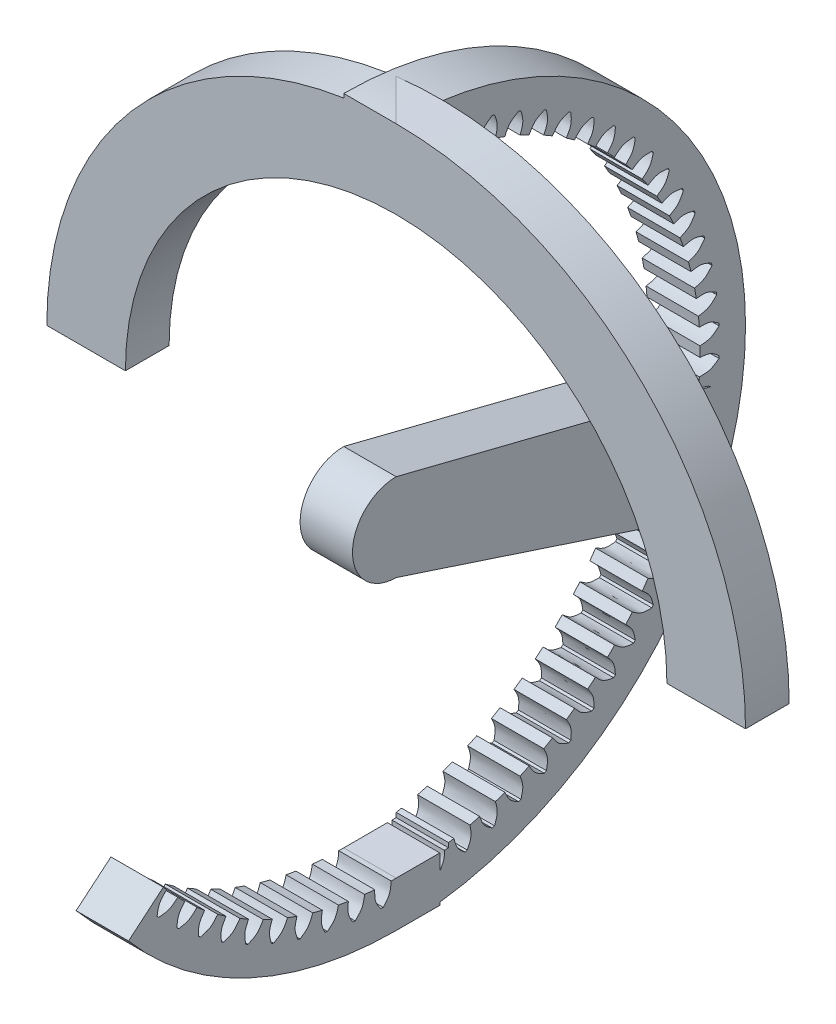
from build123d import *

# Parameters (mm, degrees)
RITNING_1_W         = 15
RITNING_1_H         = 31
KUGGLUCKA_DEPTH     = 15
CIRPATTERN_COUNT    = 72
SKETCH1_R           = 40
BOSS_EXTRUDE1_DEPTH = 6
COMBINE1_START      = -7.5
COMBINE1_DEPTH      = 15
CUT_EXTRUDE1_DEPTH  = 6
BOSS_EXTRUDE2_DEPTH = 6
SKETCH7_W           = 5
SKETCH7_H           = 9
CUT_EXTRUDE3_DEPTH  = 6


# Read off the part's stored shape, not the designer's step: Combine1
with BuildPart() as part:
    # Ritning 1 → Kugghjulsämne (revolve)
    with BuildSketch(Plane.XY, mode=Mode.PRIVATE) as kugghjuls_mne_sk:
        with Locations((0, 3)):
            Rectangle(RITNING_1_W, RITNING_1_H)
    revolve(kugghjuls_mne_sk.sketch.rotate(Axis((-7.5, -18.5, 0), (1, 0, 0)), 90), axis=Axis((-7.5, -18.5, 0), (1, 0, 0)))

    # Ritning 2 → Kugglucka (cut)
    with BuildSketch(Plane.ZY.offset(7.5)):
        with BuildLine():
            Line((1.471119099, 18.470742603), (0, 19.941861702))
            Line((0, 19.941861702), (-1.471119099, 18.470742603))
            add(Edge.make_bspline(
                [(-1.471119099, 18.470742603), (-1.203017898, 18.160678457), (-0.662530279, 17.535594229), (-0.603985126, 16.710882897), (-0.574480463, 16.295257898)],
                knots=[0, 0, 0, 0, 0.496035786, 1, 1, 1, 1], degree=3))
            ThreePointArc((-0.574480463, 16.295257898), (0, 16.3), (0.574480463, 16.295257898))
            add(Edge.make_bspline(
                [(1.471119099, 18.470742603), (1.203017898, 18.160678457), (0.662530279, 17.535594229), (0.603985126, 16.710882897), (0.574480463, 16.295257898)],
                knots=[0, 0, 0, 0, 0.496035786, 1, 1, 1, 1], degree=3))
        make_face()
    kugglucka = extrude(amount=-KUGGLUCKA_DEPTH, mode=Mode.SUBTRACT)

    # CirPattern: Kugglucka ×72 about axis
    cirpattern_axis = Axis((-7.5, -18.5, 0), (-1, 0, 0))
    for i in range(1, CIRPATTERN_COUNT):
        add(kugglucka.rotate(cirpattern_axis, i * 360 / CIRPATTERN_COUNT), mode=Mode.SUBTRACT)


with BuildPart() as body_2:
    # Sketch1 → Boss-Extrude1 (new body)
    with BuildSketch(Plane(origin=(7.5, 0, 0), x_dir=(0, 0, -1), z_dir=(1, 0, 0))):
        with Locations((0, -18.5)):
            Circle(SKETCH1_R)
    extrude(amount=-BOSS_EXTRUDE1_DEPTH)


with BuildPart() as combine1_tool:
    # Combine1 outline → Combine1 (new body)
    with BuildSketch(Plane.YZ.offset(COMBINE1_START)):
        with BuildLine():
            ThreePointArc((16.295257898, -0.574480463), (16.3, 0), (16.295257898, 0.574480463))
            add(Edge.make_bspline(
                [(16.295257898, 0.574480463), (16.710882897, 0.603985126), (17.535594229, 0.662530279), (18.160678457, 1.203017898), (18.470742603, 1.471119099)],
                knots=[0, 0, 0, 0, 0.503964214, 1, 1, 1, 1], degree=3))
            ThreePointArc((18.470742603, 1.471119099), (18.464784199, 1.613917333), (18.458274243, 1.756691485))
            add(Edge.make_bspline(
                [(18.458274243, 1.756691485), (18.126023425, 1.996748609), (17.456211232, 2.480699829), (16.629535629, 2.467143872), (16.212920708, 2.460312154)],
                knots=[0, 0, 0, 0, 0.496035786, 1, 1, 1, 1], degree=3))
            ThreePointArc((16.212920708, 2.460312154), (16.167575494, 3.033019847), (16.112782165, 3.604900938))
            add(Edge.make_bspline(
                [(16.112782165, 3.604900938), (16.524254084, 3.670517432), (17.340724595, 3.800718132), (17.916323588, 4.393628712), (18.201841288, 4.687733578)],
                knots=[0, 0, 0, 0, 0.503964214, 1, 1, 1, 1], degree=3))
            ThreePointArc((18.201841288, 4.687733578), (18.183459871, 4.829469112), (18.1645311, 4.971132586))
            add(Edge.make_bspline(
                [(18.1645311, 4.971132586), (17.81262224, 5.181318653), (17.103179757, 5.605050313), (16.280831383, 5.519496414), (15.866397232, 5.476380311)],
                knots=[0, 0, 0, 0, 0.496035786, 1, 1, 1, 1], degree=3))
            ThreePointArc((15.866397232, 5.476380311), (15.771309805, 6.042956583), (15.666882261, 6.60788594))
            add(Edge.make_bspline(
                [(15.666882261, 6.60788594), (16.07106955, 6.709114884), (16.873085406, 6.909980225), (17.394818509, 7.550801359), (17.653616799, 7.868671574)],
                knots=[0, 0, 0, 0, 0.503964214, 1, 1, 1, 1], degree=3))
            ThreePointArc((17.653616799, 7.868671574), (17.622952263, 8.008265716), (17.591748737, 8.147740366))
            add(Edge.make_bspline(
                [(17.591748737, 8.147740366), (17.222860074, 8.326455734), (16.479186586, 8.686742981), (15.66742401, 8.529842257), (15.258324721, 8.450769907)],
                knots=[0, 0, 0, 0, 0.496035786, 1, 1, 1, 1], degree=3))
            ThreePointArc((15.258324721, 8.450769907), (15.114218755, 9.00690277), (14.960951751, 9.56058094))
            add(Edge.make_bspline(
                [(14.960951751, 9.56058094), (15.354778303, 9.69665192), (16.136235677, 9.966653196), (16.600132187, 10.650507848), (16.830241457, 10.989724228)],
                knots=[0, 0, 0, 0, 0.503964214, 1, 1, 1, 1], degree=3))
            ThreePointArc((16.830241457, 10.989724228), (16.787527178, 11.126114581), (16.744286374, 11.262338922))
            add(Edge.make_bspline(
                [(16.744286374, 11.262338922), (16.361225373, 11.408223459), (15.588980684, 11.702324289), (14.793981909, 11.475270849), (14.393330976, 11.360844041)],
                knots=[0, 0, 0, 0, 0.496035786, 1, 1, 1, 1], degree=3))
            ThreePointArc((14.393330976, 11.360844041), (14.201303203, 11.902300988), (14.000363195, 12.440514146))
            add(Edge.make_bspline(
                [(14.000363195, 12.440514146), (14.38083175, 12.610391581), (15.135783282, 12.947473918), (15.538312665, 13.669157542), (15.737981644, 14.027138445)],
                knots=[0, 0, 0, 0, 0.503964214, 1, 1, 1, 1], degree=3))
            ThreePointArc((15.737981644, 14.027138445), (15.683542703, 14.159286997), (15.62859371, 14.291224279))
            add(Edge.make_bspline(
                [(15.62859371, 14.291224279), (15.234275696, 14.403167715), (14.439337055, 14.628843843), (13.667152502, 14.333365701), (13.27799912, 14.184455292)],
                knots=[0, 0, 0, 0, 0.496035786, 1, 1, 1, 1], degree=3))
            ThreePointArc((13.27799912, 14.184455292), (13.039510989, 14.707115509), (12.79242725, 15.225767527))
            add(Edge.make_bspline(
                [(12.79242725, 15.225767527), (13.156642214, 15.428158547), (13.879342265, 15.829756545), (14.21744103, 16.583776693), (14.385150117, 16.957797669)],
                knots=[0, 0, 0, 0, 0.503964214, 1, 1, 1, 1], degree=3))
            ThreePointArc((14.385150117, 16.957797669), (14.319400828, 17.08469869), (14.25316184, 17.21134479))
            add(Edge.make_bspline(
                [(14.25316184, 17.21134479), (13.850587812, 17.288495167), (13.039005183, 17.444029062), (12.295511641, 17.082374986), (11.920817503, 16.900114274)],
                knots=[0, 0, 0, 0, 0.496035786, 1, 1, 1, 1], degree=3))
            ThreePointArc((11.920817503, 16.900114274), (11.637684052, 17.4), (11.346337039, 17.895143624))
            add(Edge.make_bspline(
                [(11.346337039, 17.895143624), (11.691526515, 18.128507911), (12.376474903, 18.591565167), (12.647569914, 19.372183289), (12.782042741, 19.759397813)],
                knots=[0, 0, 0, 0, 0.503964214, 1, 1, 1, 1], degree=3))
            ThreePointArc((12.782042741, 19.759397813), (12.705483495, 19.880085509), (12.628458632, 20.000476574))
            add(Edge.make_bspline(
                [(12.628458632, 20.000476574), (12.220692422, 20.042246733), (11.398642437, 20.126454687), (10.689498342, 19.701377082), (10.332115096, 19.487153181)],
                knots=[0, 0, 0, 0, 0.496035786, 1, 1, 1, 1], degree=3))
            ThreePointArc((10.332115096, 19.487153181), (10.006491141, 19.960459985), (9.673098182, 20.428326873))
            add(Edge.make_bspline(
                [(9.673098182, 20.428326873), (9.99663507, 20.690888383), (10.638618923, 21.211880753), (10.840646984, 22.013155874), (10.940860132, 22.410617009)],
                knots=[0, 0, 0, 0, 0.503964214, 1, 1, 1, 1], degree=3))
            ThreePointArc((10.940860132, 22.410617009), (10.854073591, 22.524172873), (10.766849058, 22.637392655))
            add(Edge.make_bspline(
                [(10.766849058, 22.637392655), (10.356994012, 22.643464699), (9.530732968, 22.655705839), (8.861335335, 22.170439803), (8.523982884, 21.925883086)],
                knots=[0, 0, 0, 0, 0.496035786, 1, 1, 1, 1], degree=3))
            ThreePointArc((8.523982884, 21.925883086), (8.158346621, 22.369008817), (7.785445036, 22.806038219))
            add(Edge.make_bspline(
                [(7.785445036, 22.806038219), (8.084867025, 23.095798701), (8.679000459, 23.670761117), (8.810424013, 24.48659505), (8.8756148, 24.891277877)],
                knots=[0, 0, 0, 0, 0.503964214, 1, 1, 1, 1], degree=3))
            ThreePointArc((8.8756148, 24.891277877), (8.779261462, 24.996837682), (8.682501091, 25.102024509))
            add(Edge.make_bspline(
                [(8.682501091, 25.102024509), (8.273676453, 25.072352226), (7.449492697, 25.01253339), (6.824936046, 24.47077209), (6.510181844, 24.197743782)],
                knots=[0, 0, 0, 0, 0.496035786, 1, 1, 1, 1], degree=3))
            ThreePointArc((6.510181844, 24.197743782), (6.107315985, 24.607315985), (5.697743782, 25.010181844))
            add(Edge.make_bspline(
                [(5.697743782, 25.010181844), (5.97077209, 25.324936046), (6.51253339, 25.949492697), (6.572352226, 26.773676453), (6.602024509, 27.182501091)],
                knots=[0, 0, 0, 0, 0.503964214, 1, 1, 1, 1], degree=3))
            ThreePointArc((6.602024509, 27.182501091), (6.496837682, 27.279261462), (6.391277877, 27.3756148))
            add(Edge.make_bspline(
                [(6.391277877, 27.3756148), (5.98659505, 27.310424013), (5.170761117, 27.179000459), (4.595798701, 26.584867025), (4.306038219, 26.285445036)],
                knots=[0, 0, 0, 0, 0.496035786, 1, 1, 1, 1], degree=3))
            ThreePointArc((4.306038219, 26.285445036), (3.869008817, 26.658346621), (3.425883086, 27.023982884))
            add(Edge.make_bspline(
                [(3.425883086, 27.023982884), (3.670439803, 27.361335335), (4.155705839, 28.030732968), (4.143464699, 28.856994012), (4.137392655, 29.266849058)],
                knots=[0, 0, 0, 0, 0.503964214, 1, 1, 1, 1], degree=3))
            ThreePointArc((4.137392655, 29.266849058), (4.024172873, 29.354073591), (3.910617009, 29.440860132))
            add(Edge.make_bspline(
                [(3.910617009, 29.440860132), (3.513155874, 29.340646984), (2.711880753, 29.138618923), (2.190888383, 28.49663507), (1.928326873, 28.173098182)],
                knots=[0, 0, 0, 0, 0.496035786, 1, 1, 1, 1], degree=3))
            ThreePointArc((1.928326873, 28.173098182), (1.460459985, 28.506491141), (0.987153181, 28.832115096))
            add(Edge.make_bspline(
                [(0.987153181, 28.832115096), (1.201377082, 29.189498342), (1.626454687, 29.898642437), (1.542246733, 30.720692422), (1.500476574, 31.128458632)],
                knots=[0, 0, 0, 0, 0.503964214, 1, 1, 1, 1], degree=3))
            ThreePointArc((1.500476574, 31.128458632), (1.380085509, 31.205483495), (1.259397813, 31.282042741))
            add(Edge.make_bspline(
                [(1.259397813, 31.282042741), (0.872183289, 31.147569914), (0.091565167, 30.876474903), (-0.371492089, 30.191526515), (-0.604856376, 29.846337039)],
                knots=[0, 0, 0, 0, 0.496035786, 1, 1, 1, 1], degree=3))
            ThreePointArc((-0.604856376, 29.846337039), (-1.1, 30.137684052), (-1.599885726, 30.420817503))
            add(Edge.make_bspline(
                [(-1.599885726, 30.420817503), (-1.417625014, 30.795511641), (-1.055970938, 31.539005183), (-1.211504833, 32.350587812), (-1.28865521, 32.75316184)],
                knots=[0, 0, 0, 0, 0.503964214, 1, 1, 1, 1], degree=3))
            ThreePointArc((-1.28865521, 32.75316184), (-1.41530131, 32.819400828), (-1.542202331, 32.885150117))
            add(Edge.make_bspline(
                [(-1.542202331, 32.885150117), (-1.916223307, 32.71744103), (-2.670243455, 32.379342265), (-3.071841453, 31.656642214), (-3.274232473, 31.29242725)],
                knots=[0, 0, 0, 0, 0.496035786, 1, 1, 1, 1], degree=3))
            ThreePointArc((-3.274232473, 31.29242725), (-3.792884491, 31.539510989), (-4.315544708, 31.77799912))
            add(Edge.make_bspline(
                [(-4.315544708, 31.77799912), (-4.166634299, 32.167152502), (-3.871156157, 32.939337055), (-4.096832285, 33.734275696), (-4.208775721, 34.12859371)],
                knots=[0, 0, 0, 0, 0.503964214, 1, 1, 1, 1], degree=3))
            ThreePointArc((-4.208775721, 34.12859371), (-4.340713003, 34.183542703), (-4.472861555, 34.237981644))
            add(Edge.make_bspline(
                [(-4.472861555, 34.237981644), (-4.830842458, 34.038312665), (-5.552526082, 33.635783282), (-5.889608419, 32.88083175), (-6.059485854, 32.500363195)],
                knots=[0, 0, 0, 0, 0.496035786, 1, 1, 1, 1], degree=3))
            ThreePointArc((-6.059485854, 32.500363195), (-6.597699012, 32.701303203), (-7.139155959, 32.893330976))
            add(Edge.make_bspline(
                [(-7.139155959, 32.893330976), (-7.024729151, 33.293981909), (-6.797675711, 34.088980684), (-7.091776541, 34.861225373), (-7.237661078, 35.244286374)],
                knots=[0, 0, 0, 0, 0.503964214, 1, 1, 1, 1], degree=3))
            ThreePointArc((-7.237661078, 35.244286374), (-7.373885419, 35.287527178), (-7.510275772, 35.330241457))
            add(Edge.make_bspline(
                [(-7.510275772, 35.330241457), (-7.849492152, 35.100132187), (-8.533346804, 34.636235677), (-8.80334808, 33.854778303), (-8.93941906, 33.460951751)],
                knots=[0, 0, 0, 0, 0.496035786, 1, 1, 1, 1], degree=3))
            ThreePointArc((-8.93941906, 33.460951751), (-9.49309723, 33.614218755), (-10.049230093, 33.758324721))
            add(Edge.make_bspline(
                [(-10.049230093, 33.758324721), (-9.970157743, 34.16742401), (-9.813257019, 34.979186586), (-10.173544266, 35.722860074), (-10.352259634, 36.091748737)],
                knots=[0, 0, 0, 0, 0.503964214, 1, 1, 1, 1], degree=3))
            ThreePointArc((-10.352259634, 36.091748737), (-10.491734284, 36.122952263), (-10.631328426, 36.153616799))
            add(Edge.make_bspline(
                [(-10.631328426, 36.153616799), (-10.949198641, 35.894818509), (-11.590019775, 35.373085406), (-11.790885116, 34.57106955), (-11.89211406, 34.166882261)],
                knots=[0, 0, 0, 0, 0.496035786, 1, 1, 1, 1], degree=3))
            ThreePointArc((-11.89211406, 34.166882261), (-12.457043417, 34.271309805), (-13.023619689, 34.366397232))
            add(Edge.make_bspline(
                [(-13.023619689, 34.366397232), (-12.980503586, 34.780831383), (-12.894949687, 35.603179757), (-13.318681347, 36.31262224), (-13.528867414, 36.6645311)],
                knots=[0, 0, 0, 0, 0.503964214, 1, 1, 1, 1], degree=3))
            ThreePointArc((-13.528867414, 36.6645311), (-13.670530888, 36.683459871), (-13.812266422, 36.701841288))
            add(Edge.make_bspline(
                [(-13.812266422, 36.701841288), (-14.106371288, 36.416323588), (-14.699281868, 35.840724595), (-14.829482568, 35.024254084), (-14.895099062, 34.612782165)],
                knots=[0, 0, 0, 0, 0.496035786, 1, 1, 1, 1], degree=3))
            ThreePointArc((-14.895099062, 34.612782165), (-15.466980153, 34.667575494), (-16.039687846, 34.712920708))
            add(Edge.make_bspline(
                [(-16.039687846, 34.712920708), (-16.032856128, 35.129535629), (-16.019300171, 35.956211232), (-16.503251391, 36.626023425), (-16.743308515, 36.958274243)],
                knots=[0, 0, 0, 0, 0.503964214, 1, 1, 1, 1], degree=3))
            ThreePointArc((-16.743308515, 36.958274243), (-16.886082667, 36.964784199), (-17.028880901, 36.970742603))
            add(Edge.make_bspline(
                [(-17.028880901, 36.970742603), (-17.296982102, 36.660678457), (-17.837469721, 36.035594229), (-17.896014874, 35.210882897), (-17.925519537, 34.795257898)],
                knots=[0, 0, 0, 0, 0.496035786, 1, 1, 1, 1], degree=3))
            ThreePointArc((-17.925519537, 34.795257898), (-18.5, 34.8), (-19.074480463, 34.795257898))
            add(Edge.make_bspline(
                [(-19.074480463, 34.795257898), (-19.103985126, 35.210882897), (-19.162530279, 36.035594229), (-19.703017898, 36.660678457), (-19.971119099, 36.970742603)],
                knots=[0, 0, 0, 0, 0.503964214, 1, 1, 1, 1], degree=3))
            ThreePointArc((-19.971119099, 36.970742603), (-20.113917333, 36.964784199), (-20.256691485, 36.958274243))
            add(Edge.make_bspline(
                [(-20.256691485, 36.958274243), (-20.496748609, 36.626023425), (-20.980699829, 35.956211232), (-20.967143872, 35.129535629), (-20.960312154, 34.712920708)],
                knots=[0, 0, 0, 0, 0.496035786, 1, 1, 1, 1], degree=3))
            ThreePointArc((-20.960312154, 34.712920708), (-21.533019847, 34.667575494), (-22.104900938, 34.612782165))
            add(Edge.make_bspline(
                [(-22.104900938, 34.612782165), (-22.170517432, 35.024254084), (-22.300718132, 35.840724595), (-22.893628712, 36.416323588), (-23.187733578, 36.701841288)],
                knots=[0, 0, 0, 0, 0.503964214, 1, 1, 1, 1], degree=3))
            ThreePointArc((-23.187733578, 36.701841288), (-23.329469112, 36.683459871), (-23.471132586, 36.6645311))
            add(Edge.make_bspline(
                [(-23.471132586, 36.6645311), (-23.681318653, 36.31262224), (-24.105050313, 35.603179757), (-24.019496414, 34.780831383), (-23.976380311, 34.366397232)],
                knots=[0, 0, 0, 0, 0.496035786, 1, 1, 1, 1], degree=3))
            ThreePointArc((-23.976380311, 34.366397232), (-24.542956583, 34.271309805), (-25.10788594, 34.166882261))
            add(Edge.make_bspline(
                [(-25.10788594, 34.166882261), (-25.209114884, 34.57106955), (-25.409980225, 35.373085406), (-26.050801359, 35.894818509), (-26.368671574, 36.153616799)],
                knots=[0, 0, 0, 0, 0.503964214, 1, 1, 1, 1], degree=3))
            ThreePointArc((-26.368671574, 36.153616799), (-26.508265716, 36.122952263), (-26.647740366, 36.091748737))
            add(Edge.make_bspline(
                [(-26.647740366, 36.091748737), (-26.826455734, 35.722860074), (-27.186742981, 34.979186586), (-27.029842257, 34.16742401), (-26.950769907, 33.758324721)],
                knots=[0, 0, 0, 0, 0.496035786, 1, 1, 1, 1], degree=3))
            ThreePointArc((-26.950769907, 33.758324721), (-27.50690277, 33.614218755), (-28.06058094, 33.460951751))
            add(Edge.make_bspline(
                [(-28.06058094, 33.460951751), (-28.19665192, 33.854778303), (-28.466653196, 34.636235677), (-29.150507848, 35.100132187), (-29.489724228, 35.330241457)],
                knots=[0, 0, 0, 0, 0.503964214, 1, 1, 1, 1], degree=3))
            ThreePointArc((-29.489724228, 35.330241457), (-29.626114581, 35.287527178), (-29.762338922, 35.244286374))
            add(Edge.make_bspline(
                [(-29.762338922, 35.244286374), (-29.908223459, 34.861225373), (-30.202324289, 34.088980684), (-29.975270849, 33.293981909), (-29.860844041, 32.893330976)],
                knots=[0, 0, 0, 0, 0.496035786, 1, 1, 1, 1], degree=3))
            ThreePointArc((-29.860844041, 32.893330976), (-30.402300988, 32.701303203), (-30.940514146, 32.500363195))
            add(Edge.make_bspline(
                [(-30.940514146, 32.500363195), (-31.110391581, 32.88083175), (-31.447473918, 33.635783282), (-32.169157542, 34.038312665), (-32.527138445, 34.237981644)],
                knots=[0, 0, 0, 0, 0.503964214, 1, 1, 1, 1], degree=3))
            ThreePointArc((-32.527138445, 34.237981644), (-32.659286997, 34.183542703), (-32.791224279, 34.12859371))
            add(Edge.make_bspline(
                [(-32.791224279, 34.12859371), (-32.903167715, 33.734275696), (-33.128843843, 32.939337055), (-32.833365701, 32.167152502), (-32.684455292, 31.77799912)],
                knots=[0, 0, 0, 0, 0.496035786, 1, 1, 1, 1], degree=3))
            ThreePointArc((-32.684455292, 31.77799912), (-33.207115509, 31.539510989), (-33.725767527, 31.29242725))
            add(Edge.make_bspline(
                [(-33.725767527, 31.29242725), (-33.928158547, 31.656642214), (-34.329756545, 32.379342265), (-35.083776693, 32.71744103), (-35.457797669, 32.885150117)],
                knots=[0, 0, 0, 0, 0.503964214, 1, 1, 1, 1], degree=3))
            ThreePointArc((-35.457797669, 32.885150117), (-35.58469869, 32.819400828), (-35.71134479, 32.75316184))
            add(Edge.make_bspline(
                [(-35.71134479, 32.75316184), (-35.788495167, 32.350587812), (-35.944029062, 31.539005183), (-35.582374986, 30.795511641), (-35.400114274, 30.420817503)],
                knots=[0, 0, 0, 0, 0.496035786, 1, 1, 1, 1], degree=3))
            ThreePointArc((-35.400114274, 30.420817503), (-35.9, 30.137684052), (-36.395143624, 29.846337039))
            add(Edge.make_bspline(
                [(-36.395143624, 29.846337039), (-36.628507911, 30.191526515), (-37.091565167, 30.876474903), (-37.872183289, 31.147569914), (-38.259397813, 31.282042741)],
                knots=[0, 0, 0, 0, 0.503964214, 1, 1, 1, 1], degree=3))
            ThreePointArc((-38.259397813, 31.282042741), (-38.380085509, 31.205483495), (-38.500476574, 31.128458632))
            add(Edge.make_bspline(
                [(-38.500476574, 31.128458632), (-38.542246733, 30.720692422), (-38.626454687, 29.898642437), (-38.201377082, 29.189498342), (-37.987153181, 28.832115096)],
                knots=[0, 0, 0, 0, 0.496035786, 1, 1, 1, 1], degree=3))
            ThreePointArc((-37.987153181, 28.832115096), (-38.460459985, 28.506491141), (-38.928326873, 28.173098182))
            add(Edge.make_bspline(
                [(-38.928326873, 28.173098182), (-39.190888383, 28.49663507), (-39.711880753, 29.138618923), (-40.513155874, 29.340646984), (-40.910617009, 29.440860132)],
                knots=[0, 0, 0, 0, 0.503964214, 1, 1, 1, 1], degree=3))
            ThreePointArc((-40.910617009, 29.440860132), (-41.024172873, 29.354073591), (-41.137392655, 29.266849058))
            add(Edge.make_bspline(
                [(-41.137392655, 29.266849058), (-41.143464699, 28.856994012), (-41.155705839, 28.030732968), (-40.670439803, 27.361335335), (-40.425883086, 27.023982884)],
                knots=[0, 0, 0, 0, 0.496035786, 1, 1, 1, 1], degree=3))
            ThreePointArc((-40.425883086, 27.023982884), (-40.869008817, 26.658346621), (-41.306038219, 26.285445036))
            add(Edge.make_bspline(
                [(-41.306038219, 26.285445036), (-41.595798701, 26.584867025), (-42.170761117, 27.179000459), (-42.98659505, 27.310424013), (-43.391277877, 27.3756148)],
                knots=[0, 0, 0, 0, 0.503964214, 1, 1, 1, 1], degree=3))
            ThreePointArc((-43.391277877, 27.3756148), (-43.496837682, 27.279261462), (-43.602024509, 27.182501091))
            add(Edge.make_bspline(
                [(-43.602024509, 27.182501091), (-43.572352226, 26.773676453), (-43.51253339, 25.949492697), (-42.97077209, 25.324936046), (-42.697743782, 25.010181844)],
                knots=[0, 0, 0, 0, 0.496035786, 1, 1, 1, 1], degree=3))
            ThreePointArc((-42.697743782, 25.010181844), (-43.107315985, 24.607315985), (-43.510181844, 24.197743782))
            add(Edge.make_bspline(
                [(-43.510181844, 24.197743782), (-43.824936046, 24.47077209), (-44.449492697, 25.01253339), (-45.273676453, 25.072352226), (-45.682501091, 25.102024509)],
                knots=[0, 0, 0, 0, 0.503964214, 1, 1, 1, 1], degree=3))
            ThreePointArc((-45.682501091, 25.102024509), (-45.779261462, 24.996837682), (-45.8756148, 24.891277877))
            add(Edge.make_bspline(
                [(-45.8756148, 24.891277877), (-45.810424013, 24.48659505), (-45.679000459, 23.670761117), (-45.084867025, 23.095798701), (-44.785445036, 22.806038219)],
                knots=[0, 0, 0, 0, 0.496035786, 1, 1, 1, 1], degree=3))
            ThreePointArc((-44.785445036, 22.806038219), (-45.158346621, 22.369008817), (-45.523982884, 21.925883086))
            add(Edge.make_bspline(
                [(-45.523982884, 21.925883086), (-45.861335335, 22.170439803), (-46.530732968, 22.655705839), (-47.356994012, 22.643464699), (-47.766849058, 22.637392655)],
                knots=[0, 0, 0, 0, 0.503964214, 1, 1, 1, 1], degree=3))
            ThreePointArc((-47.766849058, 22.637392655), (-47.854073591, 22.524172873), (-47.940860132, 22.410617009))
            add(Edge.make_bspline(
                [(-47.940860132, 22.410617009), (-47.840646984, 22.013155874), (-47.638618923, 21.211880753), (-46.99663507, 20.690888383), (-46.673098182, 20.428326873)],
                knots=[0, 0, 0, 0, 0.496035786, 1, 1, 1, 1], degree=3))
            ThreePointArc((-46.673098182, 20.428326873), (-47.006491141, 19.960459985), (-47.332115096, 19.487153181))
            add(Edge.make_bspline(
                [(-47.332115096, 19.487153181), (-47.689498342, 19.701377082), (-48.398642437, 20.126454687), (-49.220692422, 20.042246733), (-49.628458632, 20.000476574)],
                knots=[0, 0, 0, 0, 0.503964214, 1, 1, 1, 1], degree=3))
            ThreePointArc((-49.628458632, 20.000476574), (-49.705483495, 19.880085509), (-49.782042741, 19.759397813))
            add(Edge.make_bspline(
                [(-49.782042741, 19.759397813), (-49.647569914, 19.372183289), (-49.376474903, 18.591565167), (-48.691526515, 18.128507911), (-48.346337039, 17.895143624)],
                knots=[0, 0, 0, 0, 0.496035786, 1, 1, 1, 1], degree=3))
            ThreePointArc((-48.346337039, 17.895143624), (-48.637684052, 17.4), (-48.920817503, 16.900114274))
            add(Edge.make_bspline(
                [(-48.920817503, 16.900114274), (-49.295511641, 17.082374986), (-50.039005183, 17.444029062), (-50.850587812, 17.288495167), (-51.25316184, 17.21134479)],
                knots=[0, 0, 0, 0, 0.503964214, 1, 1, 1, 1], degree=3))
            ThreePointArc((-51.25316184, 17.21134479), (-51.319400828, 17.08469869), (-51.385150117, 16.957797669))
            add(Edge.make_bspline(
                [(-51.385150117, 16.957797669), (-51.21744103, 16.583776693), (-50.879342265, 15.829756545), (-50.156642214, 15.428158547), (-49.79242725, 15.225767527)],
                knots=[0, 0, 0, 0, 0.496035786, 1, 1, 1, 1], degree=3))
            ThreePointArc((-49.79242725, 15.225767527), (-50.039510989, 14.707115509), (-50.27799912, 14.184455292))
            add(Edge.make_bspline(
                [(-50.27799912, 14.184455292), (-50.667152502, 14.333365701), (-51.439337055, 14.628843843), (-52.234275696, 14.403167715), (-52.62859371, 14.291224279)],
                knots=[0, 0, 0, 0, 0.503964214, 1, 1, 1, 1], degree=3))
            ThreePointArc((-52.62859371, 14.291224279), (-52.683542703, 14.159286997), (-52.737981644, 14.027138445))
            add(Edge.make_bspline(
                [(-52.737981644, 14.027138445), (-52.538312665, 13.669157542), (-52.135783282, 12.947473918), (-51.38083175, 12.610391581), (-51.000363195, 12.440514146)],
                knots=[0, 0, 0, 0, 0.496035786, 1, 1, 1, 1], degree=3))
            ThreePointArc((-51.000363195, 12.440514146), (-51.201303203, 11.902300988), (-51.393330976, 11.360844041))
            add(Edge.make_bspline(
                [(-51.393330976, 11.360844041), (-51.793981909, 11.475270849), (-52.588980684, 11.702324289), (-53.361225373, 11.408223459), (-53.744286374, 11.262338922)],
                knots=[0, 0, 0, 0, 0.503964214, 1, 1, 1, 1], degree=3))
            ThreePointArc((-53.744286374, 11.262338922), (-53.787527178, 11.126114581), (-53.830241457, 10.989724228))
            add(Edge.make_bspline(
                [(-53.830241457, 10.989724228), (-53.600132187, 10.650507848), (-53.136235677, 9.966653196), (-52.354778303, 9.69665192), (-51.960951751, 9.56058094)],
                knots=[0, 0, 0, 0, 0.496035786, 1, 1, 1, 1], degree=3))
            ThreePointArc((-51.960951751, 9.56058094), (-52.114218755, 9.00690277), (-52.258324721, 8.450769907))
            add(Edge.make_bspline(
                [(-52.258324721, 8.450769907), (-52.66742401, 8.529842257), (-53.479186586, 8.686742981), (-54.222860074, 8.326455734), (-54.591748737, 8.147740366)],
                knots=[0, 0, 0, 0, 0.503964214, 1, 1, 1, 1], degree=3))
            ThreePointArc((-54.591748737, 8.147740366), (-54.622952263, 8.008265716), (-54.653616799, 7.868671574))
            add(Edge.make_bspline(
                [(-54.653616799, 7.868671574), (-54.394818509, 7.550801359), (-53.873085406, 6.909980225), (-53.07106955, 6.709114884), (-52.666882261, 6.60788594)],
                knots=[0, 0, 0, 0, 0.496035786, 1, 1, 1, 1], degree=3))
            ThreePointArc((-52.666882261, 6.60788594), (-52.771309805, 6.042956583), (-52.866397232, 5.476380311))
            add(Edge.make_bspline(
                [(-52.866397232, 5.476380311), (-53.280831383, 5.519496414), (-54.103179757, 5.605050313), (-54.81262224, 5.181318653), (-55.1645311, 4.971132586)],
                knots=[0, 0, 0, 0, 0.503964214, 1, 1, 1, 1], degree=3))
            ThreePointArc((-55.1645311, 4.971132586), (-55.183459871, 4.829469112), (-55.201841288, 4.687733578))
            add(Edge.make_bspline(
                [(-55.201841288, 4.687733578), (-54.916323588, 4.393628712), (-54.340724595, 3.800718132), (-53.524254084, 3.670517432), (-53.112782165, 3.604900938)],
                knots=[0, 0, 0, 0, 0.496035786, 1, 1, 1, 1], degree=3))
            ThreePointArc((-53.112782165, 3.604900938), (-53.167575494, 3.033019847), (-53.212920708, 2.460312154))
            add(Edge.make_bspline(
                [(-53.212920708, 2.460312154), (-53.629535629, 2.467143872), (-54.456211232, 2.480699829), (-55.126023425, 1.996748609), (-55.458274243, 1.756691485)],
                knots=[0, 0, 0, 0, 0.503964214, 1, 1, 1, 1], degree=3))
            ThreePointArc((-55.458274243, 1.756691485), (-55.464784199, 1.613917333), (-55.470742603, 1.471119099))
            add(Edge.make_bspline(
                [(-55.470742603, 1.471119099), (-55.160678457, 1.203017898), (-54.535594229, 0.662530279), (-53.710882897, 0.603985126), (-53.295257898, 0.574480463)],
                knots=[0, 0, 0, 0, 0.496035786, 1, 1, 1, 1], degree=3))
            ThreePointArc((-53.295257898, 0.574480463), (-53.3, 0), (-53.295257898, -0.574480463))
            add(Edge.make_bspline(
                [(-53.295257898, -0.574480463), (-53.710882897, -0.603985126), (-54.535594229, -0.662530279), (-55.160678457, -1.203017898), (-55.470742603, -1.471119099)],
                knots=[0, 0, 0, 0, 0.503964214, 1, 1, 1, 1], degree=3))
            ThreePointArc((-55.470742603, -1.471119099), (-55.464784199, -1.613917333), (-55.458274243, -1.756691485))
            add(Edge.make_bspline(
                [(-55.458274243, -1.756691485), (-55.126023425, -1.996748609), (-54.456211232, -2.480699829), (-53.629535629, -2.467143872), (-53.212920708, -2.460312154)],
                knots=[0, 0, 0, 0, 0.496035786, 1, 1, 1, 1], degree=3))
            ThreePointArc((-53.212920708, -2.460312154), (-53.167575494, -3.033019847), (-53.112782165, -3.604900938))
            add(Edge.make_bspline(
                [(-53.112782165, -3.604900938), (-53.524254084, -3.670517432), (-54.340724595, -3.800718132), (-54.916323588, -4.393628712), (-55.201841288, -4.687733578)],
                knots=[0, 0, 0, 0, 0.503964214, 1, 1, 1, 1], degree=3))
            ThreePointArc((-55.201841288, -4.687733578), (-55.183459871, -4.829469112), (-55.1645311, -4.971132586))
            add(Edge.make_bspline(
                [(-55.1645311, -4.971132586), (-54.81262224, -5.181318653), (-54.103179757, -5.605050313), (-53.280831383, -5.519496414), (-52.866397232, -5.476380311)],
                knots=[0, 0, 0, 0, 0.496035786, 1, 1, 1, 1], degree=3))
            ThreePointArc((-52.866397232, -5.476380311), (-52.771309805, -6.042956583), (-52.666882261, -6.60788594))
            add(Edge.make_bspline(
                [(-52.666882261, -6.60788594), (-53.07106955, -6.709114884), (-53.873085406, -6.909980225), (-54.394818509, -7.550801359), (-54.653616799, -7.868671574)],
                knots=[0, 0, 0, 0, 0.503964214, 1, 1, 1, 1], degree=3))
            ThreePointArc((-54.653616799, -7.868671574), (-54.622952263, -8.008265716), (-54.591748737, -8.147740366))
            add(Edge.make_bspline(
                [(-54.591748737, -8.147740366), (-54.222860074, -8.326455734), (-53.479186586, -8.686742981), (-52.66742401, -8.529842257), (-52.258324721, -8.450769907)],
                knots=[0, 0, 0, 0, 0.496035786, 1, 1, 1, 1], degree=3))
            ThreePointArc((-52.258324721, -8.450769907), (-52.114218755, -9.00690277), (-51.960951751, -9.56058094))
            add(Edge.make_bspline(
                [(-51.960951751, -9.56058094), (-52.354778303, -9.69665192), (-53.136235677, -9.966653196), (-53.600132187, -10.650507848), (-53.830241457, -10.989724228)],
                knots=[0, 0, 0, 0, 0.503964214, 1, 1, 1, 1], degree=3))
            ThreePointArc((-53.830241457, -10.989724228), (-53.787527178, -11.126114581), (-53.744286374, -11.262338922))
            add(Edge.make_bspline(
                [(-53.744286374, -11.262338922), (-53.361225373, -11.408223459), (-52.588980684, -11.702324289), (-51.793981909, -11.475270849), (-51.393330976, -11.360844041)],
                knots=[0, 0, 0, 0, 0.496035786, 1, 1, 1, 1], degree=3))
            ThreePointArc((-51.393330976, -11.360844041), (-51.201303203, -11.902300988), (-51.000363195, -12.440514146))
            add(Edge.make_bspline(
                [(-51.000363195, -12.440514146), (-51.38083175, -12.610391581), (-52.135783282, -12.947473918), (-52.538312665, -13.669157542), (-52.737981644, -14.027138445)],
                knots=[0, 0, 0, 0, 0.503964214, 1, 1, 1, 1], degree=3))
            ThreePointArc((-52.737981644, -14.027138445), (-52.683542703, -14.159286997), (-52.62859371, -14.291224279))
            add(Edge.make_bspline(
                [(-52.62859371, -14.291224279), (-52.234275696, -14.403167715), (-51.439337055, -14.628843843), (-50.667152502, -14.333365701), (-50.27799912, -14.184455292)],
                knots=[0, 0, 0, 0, 0.496035786, 1, 1, 1, 1], degree=3))
            ThreePointArc((-50.27799912, -14.184455292), (-50.039510989, -14.707115509), (-49.79242725, -15.225767527))
            add(Edge.make_bspline(
                [(-49.79242725, -15.225767527), (-50.156642214, -15.428158547), (-50.879342265, -15.829756545), (-51.21744103, -16.583776693), (-51.385150117, -16.957797669)],
                knots=[0, 0, 0, 0, 0.503964214, 1, 1, 1, 1], degree=3))
            ThreePointArc((-51.385150117, -16.957797669), (-51.319400828, -17.08469869), (-51.25316184, -17.21134479))
            add(Edge.make_bspline(
                [(-51.25316184, -17.21134479), (-50.850587812, -17.288495167), (-50.039005183, -17.444029062), (-49.295511641, -17.082374986), (-48.920817503, -16.900114274)],
                knots=[0, 0, 0, 0, 0.496035786, 1, 1, 1, 1], degree=3))
            ThreePointArc((-48.920817503, -16.900114274), (-48.637684052, -17.4), (-48.346337039, -17.895143624))
            add(Edge.make_bspline(
                [(-48.346337039, -17.895143624), (-48.691526515, -18.128507911), (-49.376474903, -18.591565167), (-49.647569914, -19.372183289), (-49.782042741, -19.759397813)],
                knots=[0, 0, 0, 0, 0.503964214, 1, 1, 1, 1], degree=3))
            ThreePointArc((-49.782042741, -19.759397813), (-49.705483495, -19.880085509), (-49.628458632, -20.000476574))
            add(Edge.make_bspline(
                [(-49.628458632, -20.000476574), (-49.220692422, -20.042246733), (-48.398642437, -20.126454687), (-47.689498342, -19.701377082), (-47.332115096, -19.487153181)],
                knots=[0, 0, 0, 0, 0.496035786, 1, 1, 1, 1], degree=3))
            ThreePointArc((-47.332115096, -19.487153181), (-47.006491141, -19.960459985), (-46.673098182, -20.428326873))
            add(Edge.make_bspline(
                [(-46.673098182, -20.428326873), (-46.99663507, -20.690888383), (-47.638618923, -21.211880753), (-47.840646984, -22.013155874), (-47.940860132, -22.410617009)],
                knots=[0, 0, 0, 0, 0.503964214, 1, 1, 1, 1], degree=3))
            ThreePointArc((-47.940860132, -22.410617009), (-47.854073591, -22.524172873), (-47.766849058, -22.637392655))
            add(Edge.make_bspline(
                [(-47.766849058, -22.637392655), (-47.356994012, -22.643464699), (-46.530732968, -22.655705839), (-45.861335335, -22.170439803), (-45.523982884, -21.925883086)],
                knots=[0, 0, 0, 0, 0.496035786, 1, 1, 1, 1], degree=3))
            ThreePointArc((-45.523982884, -21.925883086), (-45.158346621, -22.369008817), (-44.785445036, -22.806038219))
            add(Edge.make_bspline(
                [(-44.785445036, -22.806038219), (-45.084867025, -23.095798701), (-45.679000459, -23.670761117), (-45.810424013, -24.48659505), (-45.8756148, -24.891277877)],
                knots=[0, 0, 0, 0, 0.503964214, 1, 1, 1, 1], degree=3))
            ThreePointArc((-45.8756148, -24.891277877), (-45.779261462, -24.996837682), (-45.682501091, -25.102024509))
            add(Edge.make_bspline(
                [(-45.682501091, -25.102024509), (-45.273676453, -25.072352226), (-44.449492697, -25.01253339), (-43.824936046, -24.47077209), (-43.510181844, -24.197743782)],
                knots=[0, 0, 0, 0, 0.496035786, 1, 1, 1, 1], degree=3))
            ThreePointArc((-43.510181844, -24.197743782), (-43.107315985, -24.607315985), (-42.697743782, -25.010181844))
            add(Edge.make_bspline(
                [(-42.697743782, -25.010181844), (-42.97077209, -25.324936046), (-43.51253339, -25.949492697), (-43.572352226, -26.773676453), (-43.602024509, -27.182501091)],
                knots=[0, 0, 0, 0, 0.503964214, 1, 1, 1, 1], degree=3))
            ThreePointArc((-43.602024509, -27.182501091), (-43.496837682, -27.279261462), (-43.391277877, -27.3756148))
            add(Edge.make_bspline(
                [(-43.391277877, -27.3756148), (-42.98659505, -27.310424013), (-42.170761117, -27.179000459), (-41.595798701, -26.584867025), (-41.306038219, -26.285445036)],
                knots=[0, 0, 0, 0, 0.496035786, 1, 1, 1, 1], degree=3))
            ThreePointArc((-41.306038219, -26.285445036), (-40.869008817, -26.658346621), (-40.425883086, -27.023982884))
            add(Edge.make_bspline(
                [(-40.425883086, -27.023982884), (-40.670439803, -27.361335335), (-41.155705839, -28.030732968), (-41.143464699, -28.856994012), (-41.137392655, -29.266849058)],
                knots=[0, 0, 0, 0, 0.503964214, 1, 1, 1, 1], degree=3))
            ThreePointArc((-41.137392655, -29.266849058), (-41.024172873, -29.354073591), (-40.910617009, -29.440860132))
            add(Edge.make_bspline(
                [(-40.910617009, -29.440860132), (-40.513155874, -29.340646984), (-39.711880753, -29.138618923), (-39.190888383, -28.49663507), (-38.928326873, -28.173098182)],
                knots=[0, 0, 0, 0, 0.496035786, 1, 1, 1, 1], degree=3))
            ThreePointArc((-38.928326873, -28.173098182), (-38.460459985, -28.506491141), (-37.987153181, -28.832115096))
            add(Edge.make_bspline(
                [(-37.987153181, -28.832115096), (-38.201377082, -29.189498342), (-38.626454687, -29.898642437), (-38.542246733, -30.720692422), (-38.500476574, -31.128458632)],
                knots=[0, 0, 0, 0, 0.503964214, 1, 1, 1, 1], degree=3))
            ThreePointArc((-38.500476574, -31.128458632), (-38.380085509, -31.205483495), (-38.259397813, -31.282042741))
            add(Edge.make_bspline(
                [(-38.259397813, -31.282042741), (-37.872183289, -31.147569914), (-37.091565167, -30.876474903), (-36.628507911, -30.191526515), (-36.395143624, -29.846337039)],
                knots=[0, 0, 0, 0, 0.496035786, 1, 1, 1, 1], degree=3))
            ThreePointArc((-36.395143624, -29.846337039), (-35.9, -30.137684052), (-35.400114274, -30.420817503))
            add(Edge.make_bspline(
                [(-35.400114274, -30.420817503), (-35.582374986, -30.795511641), (-35.944029062, -31.539005183), (-35.788495167, -32.350587812), (-35.71134479, -32.75316184)],
                knots=[0, 0, 0, 0, 0.503964214, 1, 1, 1, 1], degree=3))
            ThreePointArc((-35.71134479, -32.75316184), (-35.58469869, -32.819400828), (-35.457797669, -32.885150117))
            add(Edge.make_bspline(
                [(-35.457797669, -32.885150117), (-35.083776693, -32.71744103), (-34.329756545, -32.379342265), (-33.928158547, -31.656642214), (-33.725767527, -31.29242725)],
                knots=[0, 0, 0, 0, 0.496035786, 1, 1, 1, 1], degree=3))
            ThreePointArc((-33.725767527, -31.29242725), (-33.207115509, -31.539510989), (-32.684455292, -31.77799912))
            add(Edge.make_bspline(
                [(-32.684455292, -31.77799912), (-32.833365701, -32.167152502), (-33.128843843, -32.939337055), (-32.903167715, -33.734275696), (-32.791224279, -34.12859371)],
                knots=[0, 0, 0, 0, 0.503964214, 1, 1, 1, 1], degree=3))
            ThreePointArc((-32.791224279, -34.12859371), (-32.659286997, -34.183542703), (-32.527138445, -34.237981644))
            add(Edge.make_bspline(
                [(-32.527138445, -34.237981644), (-32.169157542, -34.038312665), (-31.447473918, -33.635783282), (-31.110391581, -32.88083175), (-30.940514146, -32.500363195)],
                knots=[0, 0, 0, 0, 0.496035786, 1, 1, 1, 1], degree=3))
            ThreePointArc((-30.940514146, -32.500363195), (-30.402300988, -32.701303203), (-29.860844041, -32.893330976))
            add(Edge.make_bspline(
                [(-29.860844041, -32.893330976), (-29.975270849, -33.293981909), (-30.202324289, -34.088980684), (-29.908223459, -34.861225373), (-29.762338922, -35.244286374)],
                knots=[0, 0, 0, 0, 0.503964214, 1, 1, 1, 1], degree=3))
            ThreePointArc((-29.762338922, -35.244286374), (-29.626114581, -35.287527178), (-29.489724228, -35.330241457))
            add(Edge.make_bspline(
                [(-29.489724228, -35.330241457), (-29.150507848, -35.100132187), (-28.466653196, -34.636235677), (-28.19665192, -33.854778303), (-28.06058094, -33.460951751)],
                knots=[0, 0, 0, 0, 0.496035786, 1, 1, 1, 1], degree=3))
            ThreePointArc((-28.06058094, -33.460951751), (-27.50690277, -33.614218755), (-26.950769907, -33.758324721))
            add(Edge.make_bspline(
                [(-26.950769907, -33.758324721), (-27.029842257, -34.16742401), (-27.186742981, -34.979186586), (-26.826455734, -35.722860074), (-26.647740366, -36.091748737)],
                knots=[0, 0, 0, 0, 0.503964214, 1, 1, 1, 1], degree=3))
            ThreePointArc((-26.647740366, -36.091748737), (-26.508265716, -36.122952263), (-26.368671574, -36.153616799))
            add(Edge.make_bspline(
                [(-26.368671574, -36.153616799), (-26.050801359, -35.894818509), (-25.409980225, -35.373085406), (-25.209114884, -34.57106955), (-25.10788594, -34.166882261)],
                knots=[0, 0, 0, 0, 0.496035786, 1, 1, 1, 1], degree=3))
            ThreePointArc((-25.10788594, -34.166882261), (-24.542956583, -34.271309805), (-23.976380311, -34.366397232))
            add(Edge.make_bspline(
                [(-23.976380311, -34.366397232), (-24.019496414, -34.780831383), (-24.105050313, -35.603179757), (-23.681318653, -36.31262224), (-23.471132586, -36.6645311)],
                knots=[0, 0, 0, 0, 0.503964214, 1, 1, 1, 1], degree=3))
            ThreePointArc((-23.471132586, -36.6645311), (-23.329469112, -36.683459871), (-23.187733578, -36.701841288))
            add(Edge.make_bspline(
                [(-23.187733578, -36.701841288), (-22.893628712, -36.416323588), (-22.300718132, -35.840724595), (-22.170517432, -35.024254084), (-22.104900938, -34.612782165)],
                knots=[0, 0, 0, 0, 0.496035786, 1, 1, 1, 1], degree=3))
            ThreePointArc((-22.104900938, -34.612782165), (-21.533019847, -34.667575494), (-20.960312154, -34.712920708))
            add(Edge.make_bspline(
                [(-20.960312154, -34.712920708), (-20.967143872, -35.129535629), (-20.980699829, -35.956211232), (-20.496748609, -36.626023425), (-20.256691485, -36.958274243)],
                knots=[0, 0, 0, 0, 0.503964214, 1, 1, 1, 1], degree=3))
            ThreePointArc((-20.256691485, -36.958274243), (-20.113917333, -36.964784199), (-19.971119099, -36.970742603))
            add(Edge.make_bspline(
                [(-19.971119099, -36.970742603), (-19.703017898, -36.660678457), (-19.162530279, -36.035594229), (-19.103985126, -35.210882897), (-19.074480463, -34.795257898)],
                knots=[0, 0, 0, 0, 0.496035786, 1, 1, 1, 1], degree=3))
            ThreePointArc((-19.074480463, -34.795257898), (-18.5, -34.8), (-17.925519537, -34.795257898))
            add(Edge.make_bspline(
                [(-17.925519537, -34.795257898), (-17.896014874, -35.210882897), (-17.837469721, -36.035594229), (-17.296982102, -36.660678457), (-17.028880901, -36.970742603)],
                knots=[0, 0, 0, 0, 0.503964214, 1, 1, 1, 1], degree=3))
            ThreePointArc((-17.028880901, -36.970742603), (-16.886082667, -36.964784199), (-16.743308515, -36.958274243))
            add(Edge.make_bspline(
                [(-16.743308515, -36.958274243), (-16.503251391, -36.626023425), (-16.019300171, -35.956211232), (-16.032856128, -35.129535629), (-16.039687846, -34.712920708)],
                knots=[0, 0, 0, 0, 0.496035786, 1, 1, 1, 1], degree=3))
            ThreePointArc((-16.039687846, -34.712920708), (-15.466980153, -34.667575494), (-14.895099062, -34.612782165))
            add(Edge.make_bspline(
                [(-14.895099062, -34.612782165), (-14.829482568, -35.024254084), (-14.699281868, -35.840724595), (-14.106371288, -36.416323588), (-13.812266422, -36.701841288)],
                knots=[0, 0, 0, 0, 0.503964214, 1, 1, 1, 1], degree=3))
            ThreePointArc((-13.812266422, -36.701841288), (-13.670530888, -36.683459871), (-13.528867414, -36.6645311))
            add(Edge.make_bspline(
                [(-13.528867414, -36.6645311), (-13.318681347, -36.31262224), (-12.894949687, -35.603179757), (-12.980503586, -34.780831383), (-13.023619689, -34.366397232)],
                knots=[0, 0, 0, 0, 0.496035786, 1, 1, 1, 1], degree=3))
            ThreePointArc((-13.023619689, -34.366397232), (-12.457043417, -34.271309805), (-11.89211406, -34.166882261))
            add(Edge.make_bspline(
                [(-11.89211406, -34.166882261), (-11.790885116, -34.57106955), (-11.590019775, -35.373085406), (-10.949198641, -35.894818509), (-10.631328426, -36.153616799)],
                knots=[0, 0, 0, 0, 0.503964214, 1, 1, 1, 1], degree=3))
            ThreePointArc((-10.631328426, -36.153616799), (-10.491734284, -36.122952263), (-10.352259634, -36.091748737))
            add(Edge.make_bspline(
                [(-10.352259634, -36.091748737), (-10.173544266, -35.722860074), (-9.813257019, -34.979186586), (-9.970157743, -34.16742401), (-10.049230093, -33.758324721)],
                knots=[0, 0, 0, 0, 0.496035786, 1, 1, 1, 1], degree=3))
            ThreePointArc((-10.049230093, -33.758324721), (-9.49309723, -33.614218755), (-8.93941906, -33.460951751))
            add(Edge.make_bspline(
                [(-8.93941906, -33.460951751), (-8.80334808, -33.854778303), (-8.533346804, -34.636235677), (-7.849492152, -35.100132187), (-7.510275772, -35.330241457)],
                knots=[0, 0, 0, 0, 0.503964214, 1, 1, 1, 1], degree=3))
            ThreePointArc((-7.510275772, -35.330241457), (-7.373885419, -35.287527178), (-7.237661078, -35.244286374))
            add(Edge.make_bspline(
                [(-7.237661078, -35.244286374), (-7.091776541, -34.861225373), (-6.797675711, -34.088980684), (-7.024729151, -33.293981909), (-7.139155959, -32.893330976)],
                knots=[0, 0, 0, 0, 0.496035786, 1, 1, 1, 1], degree=3))
            ThreePointArc((-7.139155959, -32.893330976), (-6.597699012, -32.701303203), (-6.059485854, -32.500363195))
            add(Edge.make_bspline(
                [(-6.059485854, -32.500363195), (-5.889608419, -32.88083175), (-5.552526082, -33.635783282), (-4.830842458, -34.038312665), (-4.472861555, -34.237981644)],
                knots=[0, 0, 0, 0, 0.503964214, 1, 1, 1, 1], degree=3))
            ThreePointArc((-4.472861555, -34.237981644), (-4.340713003, -34.183542703), (-4.208775721, -34.12859371))
            add(Edge.make_bspline(
                [(-4.208775721, -34.12859371), (-4.096832285, -33.734275696), (-3.871156157, -32.939337055), (-4.166634299, -32.167152502), (-4.315544708, -31.77799912)],
                knots=[0, 0, 0, 0, 0.496035786, 1, 1, 1, 1], degree=3))
            ThreePointArc((-4.315544708, -31.77799912), (-3.792884491, -31.539510989), (-3.274232473, -31.29242725))
            add(Edge.make_bspline(
                [(-3.274232473, -31.29242725), (-3.071841453, -31.656642214), (-2.670243455, -32.379342265), (-1.916223307, -32.71744103), (-1.542202331, -32.885150117)],
                knots=[0, 0, 0, 0, 0.503964214, 1, 1, 1, 1], degree=3))
            ThreePointArc((-1.542202331, -32.885150117), (-1.41530131, -32.819400828), (-1.28865521, -32.75316184))
            add(Edge.make_bspline(
                [(-1.28865521, -32.75316184), (-1.211504833, -32.350587812), (-1.055970938, -31.539005183), (-1.417625014, -30.795511641), (-1.599885726, -30.420817503)],
                knots=[0, 0, 0, 0, 0.496035786, 1, 1, 1, 1], degree=3))
            ThreePointArc((-1.599885726, -30.420817503), (-1.1, -30.137684052), (-0.604856376, -29.846337039))
            add(Edge.make_bspline(
                [(-0.604856376, -29.846337039), (-0.371492089, -30.191526515), (0.091565167, -30.876474903), (0.872183289, -31.147569914), (1.259397813, -31.282042741)],
                knots=[0, 0, 0, 0, 0.503964214, 1, 1, 1, 1], degree=3))
            ThreePointArc((1.259397813, -31.282042741), (1.380085509, -31.205483495), (1.500476574, -31.128458632))
            add(Edge.make_bspline(
                [(1.500476574, -31.128458632), (1.542246733, -30.720692422), (1.626454687, -29.898642437), (1.201377082, -29.189498342), (0.987153181, -28.832115096)],
                knots=[0, 0, 0, 0, 0.496035786, 1, 1, 1, 1], degree=3))
            ThreePointArc((0.987153181, -28.832115096), (1.460459985, -28.506491141), (1.928326873, -28.173098182))
            add(Edge.make_bspline(
                [(1.928326873, -28.173098182), (2.190888383, -28.49663507), (2.711880753, -29.138618923), (3.513155874, -29.340646984), (3.910617009, -29.440860132)],
                knots=[0, 0, 0, 0, 0.503964214, 1, 1, 1, 1], degree=3))
            ThreePointArc((3.910617009, -29.440860132), (4.024172873, -29.354073591), (4.137392655, -29.266849058))
            add(Edge.make_bspline(
                [(4.137392655, -29.266849058), (4.143464699, -28.856994012), (4.155705839, -28.030732968), (3.670439803, -27.361335335), (3.425883086, -27.023982884)],
                knots=[0, 0, 0, 0, 0.496035786, 1, 1, 1, 1], degree=3))
            ThreePointArc((3.425883086, -27.023982884), (3.869008817, -26.658346621), (4.306038219, -26.285445036))
            add(Edge.make_bspline(
                [(4.306038219, -26.285445036), (4.595798701, -26.584867025), (5.170761117, -27.179000459), (5.98659505, -27.310424013), (6.391277877, -27.3756148)],
                knots=[0, 0, 0, 0, 0.503964214, 1, 1, 1, 1], degree=3))
            ThreePointArc((6.391277877, -27.3756148), (6.496837682, -27.279261462), (6.602024509, -27.182501091))
            add(Edge.make_bspline(
                [(6.602024509, -27.182501091), (6.572352226, -26.773676453), (6.51253339, -25.949492697), (5.97077209, -25.324936046), (5.697743782, -25.010181844)],
                knots=[0, 0, 0, 0, 0.496035786, 1, 1, 1, 1], degree=3))
            ThreePointArc((5.697743782, -25.010181844), (6.107315985, -24.607315985), (6.510181844, -24.197743782))
            add(Edge.make_bspline(
                [(6.510181844, -24.197743782), (6.824936046, -24.47077209), (7.449492697, -25.01253339), (8.273676453, -25.072352226), (8.682501091, -25.102024509)],
                knots=[0, 0, 0, 0, 0.503964214, 1, 1, 1, 1], degree=3))
            ThreePointArc((8.682501091, -25.102024509), (8.779261462, -24.996837682), (8.8756148, -24.891277877))
            add(Edge.make_bspline(
                [(8.8756148, -24.891277877), (8.810424013, -24.48659505), (8.679000459, -23.670761117), (8.084867025, -23.095798701), (7.785445036, -22.806038219)],
                knots=[0, 0, 0, 0, 0.496035786, 1, 1, 1, 1], degree=3))
            ThreePointArc((7.785445036, -22.806038219), (8.158346621, -22.369008817), (8.523982884, -21.925883086))
            add(Edge.make_bspline(
                [(8.523982884, -21.925883086), (8.861335335, -22.170439803), (9.530732968, -22.655705839), (10.356994012, -22.643464699), (10.766849058, -22.637392655)],
                knots=[0, 0, 0, 0, 0.503964214, 1, 1, 1, 1], degree=3))
            ThreePointArc((10.766849058, -22.637392655), (10.854073591, -22.524172873), (10.940860132, -22.410617009))
            add(Edge.make_bspline(
                [(10.940860132, -22.410617009), (10.840646984, -22.013155874), (10.638618923, -21.211880753), (9.99663507, -20.690888383), (9.673098182, -20.428326873)],
                knots=[0, 0, 0, 0, 0.496035786, 1, 1, 1, 1], degree=3))
            ThreePointArc((9.673098182, -20.428326873), (10.006491141, -19.960459985), (10.332115096, -19.487153181))
            add(Edge.make_bspline(
                [(10.332115096, -19.487153181), (10.689498342, -19.701377082), (11.398642437, -20.126454687), (12.220692422, -20.042246733), (12.628458632, -20.000476574)],
                knots=[0, 0, 0, 0, 0.503964214, 1, 1, 1, 1], degree=3))
            ThreePointArc((12.628458632, -20.000476574), (12.705483495, -19.880085509), (12.782042741, -19.759397813))
            add(Edge.make_bspline(
                [(12.782042741, -19.759397813), (12.647569914, -19.372183289), (12.376474903, -18.591565167), (11.691526515, -18.128507911), (11.346337039, -17.895143624)],
                knots=[0, 0, 0, 0, 0.496035786, 1, 1, 1, 1], degree=3))
            ThreePointArc((11.346337039, -17.895143624), (11.637684052, -17.4), (11.920817503, -16.900114274))
            add(Edge.make_bspline(
                [(11.920817503, -16.900114274), (12.295511641, -17.082374986), (13.039005183, -17.444029062), (13.850587812, -17.288495167), (14.25316184, -17.21134479)],
                knots=[0, 0, 0, 0, 0.503964214, 1, 1, 1, 1], degree=3))
            ThreePointArc((14.25316184, -17.21134479), (14.319400828, -17.08469869), (14.385150117, -16.957797669))
            add(Edge.make_bspline(
                [(14.385150117, -16.957797669), (14.21744103, -16.583776693), (13.879342265, -15.829756545), (13.156642214, -15.428158547), (12.79242725, -15.225767527)],
                knots=[0, 0, 0, 0, 0.496035786, 1, 1, 1, 1], degree=3))
            ThreePointArc((12.79242725, -15.225767527), (13.039510989, -14.707115509), (13.27799912, -14.184455292))
            add(Edge.make_bspline(
                [(13.27799912, -14.184455292), (13.667152502, -14.333365701), (14.439337055, -14.628843843), (15.234275696, -14.403167715), (15.62859371, -14.291224279)],
                knots=[0, 0, 0, 0, 0.503964214, 1, 1, 1, 1], degree=3))
            ThreePointArc((15.62859371, -14.291224279), (15.683542703, -14.159286997), (15.737981644, -14.027138445))
            add(Edge.make_bspline(
                [(15.737981644, -14.027138445), (15.538312665, -13.669157542), (15.135783282, -12.947473918), (14.38083175, -12.610391581), (14.000363195, -12.440514146)],
                knots=[0, 0, 0, 0, 0.496035786, 1, 1, 1, 1], degree=3))
            ThreePointArc((14.000363195, -12.440514146), (14.201303203, -11.902300988), (14.393330976, -11.360844041))
            add(Edge.make_bspline(
                [(14.393330976, -11.360844041), (14.793981909, -11.475270849), (15.588980684, -11.702324289), (16.361225373, -11.408223459), (16.744286374, -11.262338922)],
                knots=[0, 0, 0, 0, 0.503964214, 1, 1, 1, 1], degree=3))
            ThreePointArc((16.744286374, -11.262338922), (16.787527178, -11.126114581), (16.830241457, -10.989724228))
            add(Edge.make_bspline(
                [(16.830241457, -10.989724228), (16.600132187, -10.650507848), (16.136235677, -9.966653196), (15.354778303, -9.69665192), (14.960951751, -9.56058094)],
                knots=[0, 0, 0, 0, 0.496035786, 1, 1, 1, 1], degree=3))
            ThreePointArc((14.960951751, -9.56058094), (15.114218755, -9.00690277), (15.258324721, -8.450769907))
            add(Edge.make_bspline(
                [(15.258324721, -8.450769907), (15.66742401, -8.529842257), (16.479186586, -8.686742981), (17.222860074, -8.326455734), (17.591748737, -8.147740366)],
                knots=[0, 0, 0, 0, 0.503964214, 1, 1, 1, 1], degree=3))
            ThreePointArc((17.591748737, -8.147740366), (17.622952263, -8.008265716), (17.653616799, -7.868671574))
            add(Edge.make_bspline(
                [(17.653616799, -7.868671574), (17.394818509, -7.550801359), (16.873085406, -6.909980225), (16.07106955, -6.709114884), (15.666882261, -6.60788594)],
                knots=[0, 0, 0, 0, 0.496035786, 1, 1, 1, 1], degree=3))
            ThreePointArc((15.666882261, -6.60788594), (15.771309805, -6.042956583), (15.866397232, -5.476380311))
            add(Edge.make_bspline(
                [(15.866397232, -5.476380311), (16.280831383, -5.519496414), (17.103179757, -5.605050313), (17.81262224, -5.181318653), (18.1645311, -4.971132586)],
                knots=[0, 0, 0, 0, 0.503964214, 1, 1, 1, 1], degree=3))
            ThreePointArc((18.1645311, -4.971132586), (18.183459871, -4.829469112), (18.201841288, -4.687733578))
            add(Edge.make_bspline(
                [(18.201841288, -4.687733578), (17.916323588, -4.393628712), (17.340724595, -3.800718132), (16.524254084, -3.670517432), (16.112782165, -3.604900938)],
                knots=[0, 0, 0, 0, 0.496035786, 1, 1, 1, 1], degree=3))
            ThreePointArc((16.112782165, -3.604900938), (16.167575494, -3.033019847), (16.212920708, -2.460312154))
            add(Edge.make_bspline(
                [(16.212920708, -2.460312154), (16.629535629, -2.467143872), (17.456211232, -2.480699829), (18.126023425, -1.996748609), (18.458274243, -1.756691485)],
                knots=[0, 0, 0, 0, 0.503964214, 1, 1, 1, 1], degree=3))
            ThreePointArc((18.458274243, -1.756691485), (18.464784199, -1.613917333), (18.470742603, -1.471119099))
            add(Edge.make_bspline(
                [(18.470742603, -1.471119099), (18.160678457, -1.203017898), (17.535594229, -0.662530279), (16.710882897, -0.603985126), (16.295257898, -0.574480463)],
                knots=[0, 0, 0, 0, 0.496035786, 1, 1, 1, 1], degree=3))
        make_face()
    extrude(amount=COMBINE1_DEPTH)


with BuildPart() as part_1:
    add(part.part)

    # Combine1: cut by combine1_tool
    add(combine1_tool.part, mode=Mode.SUBTRACT)


with BuildPart() as body_2_1:
    add(body_2.part)

    # Combine1: cut by combine1_tool
    add(combine1_tool.part, mode=Mode.SUBTRACT)

    # Sketch3 → Cut-Extrude1 (cut)
    with BuildSketch(Plane(origin=(7.5, 0, 0), x_dir=(0, 0, -1), z_dir=(1, 0, 0))):
        Polygon((0, 21.5), (0, -18.5), (-34.681656907, -47.60136552), (-51.927824579, -62.072618452), (-51.927824579, 21.5), align=None)
    extrude(amount=-CUT_EXTRUDE1_DEPTH, mode=Mode.SUBTRACT)

    # Sketch6 → Boss-Extrude2 (add)
    with BuildSketch(Plane(origin=(7.5, 0, 0), x_dir=(0, 0, -1), z_dir=(1, 0, 0))):
        with BuildLine():
            Line((2.369329532, -14.097014925), (0, -13.5))
            ThreePointArc((0, -13.5), (-5, -18.5), (0, -23.5))
            ThreePointArc((0, -23.5), (3.535533906, -22.035533906), (5, -18.5))
            ThreePointArc((5, -18.5), (4.292239955, -15.935496896), (2.369329532, -14.097014925))
        make_face()
        with BuildLine():
            Line((39.686269666, -23.5), (2.369329532, -14.097014925))
            ThreePointArc((2.369329532, -14.097014925), (4.292239955, -15.935496896), (5, -18.5))
            ThreePointArc((5, -18.5), (3.535533906, -22.035533906), (0, -23.5))
            Line((0, -23.5), (36.252311481, -35.40473047))
            Line((36.252311481, -35.40473047), (39.686269666, -23.5))
        make_face()
    extrude(amount=-BOSS_EXTRUDE2_DEPTH)

    # Sketch7 → Revolve2 (revolve)
    with BuildSketch(Plane(origin=(7.5, 0, 0), x_dir=(0, 0, -1), z_dir=(1, 0, 0)), mode=Mode.PRIVATE) as revolve2_sk:
        with Locations((2.5, 17)):
            Rectangle(SKETCH7_W, SKETCH7_H)
    revolve(revolve2_sk.sketch.rotate(Axis((7.5, -18.5, 38.034733349), (0, 0, -1)), 90), axis=Axis((7.5, -18.5, 38.034733349), (0, 0, -1)))

    # Sketch8 → Cut-Extrude3 (cut)
    with BuildSketch(Plane.XY):
        with BuildLine():
            Line((47.5, -18.5), (38.5, -18.5))
            ThreePointArc((38.5, -18.5), (7.5, -49.5), (-23.5, -18.5))
            Line((-23.5, -18.5), (-32.5, -18.5))
            ThreePointArc((-32.5, -18.5), (-22.831501776, -44.576809621), (1.5, -58.047439867))
            Line((1.5, -58.047439867), (1.5, -53.3))
            Line((1.5, -53.3), (7.5, -53.3))
            Line((7.5, -53.3), (7.5, -58.5))
            ThreePointArc((7.5, -58.5), (35.784271247, -46.784271247), (47.5, -18.5))
        make_face()
    extrude(amount=-CUT_EXTRUDE3_DEPTH, mode=Mode.SUBTRACT)


solid = body_2_1.part
